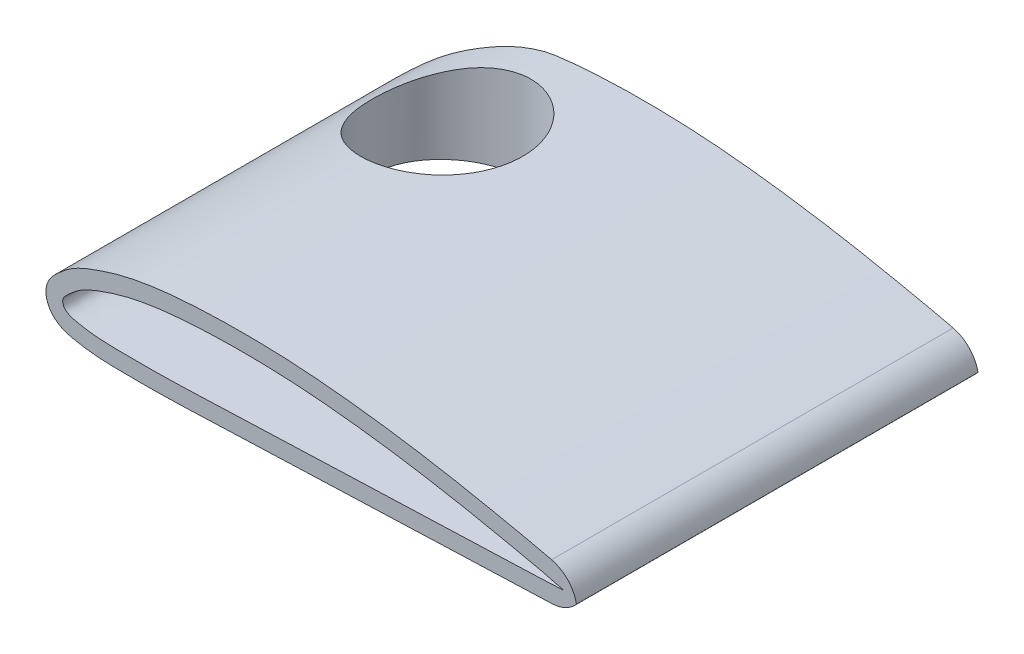
from build123d import *

# Parameters (mm, degrees)
BOSS_EXTRUDE1_DEPTH             = 120
BOSS_EXTRUDE2_DEPTH             = 10
BOSS_EXTRUDE3_REACH             = 199.677
SKETCH4_W                       = 65
SKETCH4_H                       = 65
BOSS_EXTRUDE3_DIRECTION_2_REACH = 199.677
CUT_EXTRUDE1_DEPTH              = 33
CUT_EXTRUDE1_DEPTH_BACK         = 25
SKETCH4_2_R                     = 22.5
FILLET1_START                   = -1
FILLET1_DEPTH                   = 121
CUT_EXTRUDE2_DEPTH              = 20
CUT_EXTRUDE2_DEPTH_BACK         = 15


with BuildPart() as part:
    # Sketch1 → Boss-Extrude1 (new body)
    with BuildSketch(Plane.XY):
        with BuildLine():
            Line((155.964316355, 3.565709543), (153.766293041, -4.802384858))
            add(Edge.make_bspline(
                [(155.964316355, 3.565709543), (154.378918322, 3.982141489), (151.221438672, 4.810628214), (146.405320696, 6.079621314), (141.459245587, 7.230960659), (136.616503343, 8.262254652), (131.802332964, 9.280625302), (125.348017994, 10.621960321), (117.229574348, 12.22271703), (107.436037499, 13.939301482), (97.598738468, 15.440763267), (87.722266926, 16.70627728), (77.809714958, 17.733057917), (67.80793717, 18.447035533), (57.793889713, 18.773182879), (47.769770538, 18.735457883), (39.427372262, 18.401151216), (32.680462384, 17.878299596), (27.594300218, 17.298704257), (22.489228117, 16.489212541), (18.221832789, 15.571293682), (14.817024759, 14.645782316), (12.31084577, 13.860390887), (9.867125223, 13.00783032), (7.415344177, 12.101980937), (5.199464012, 11.150322343), (3.406195729, 10.198694172), (2.068067577, 9.360164368), (0.853940441, 8.472821349), (-0.27162176, 7.553930707), (-1.173806492, 6.752832287), (-1.846273696, 6.138489504), (-2.510294599, 5.508824521), (-3.293762827, 4.650066841), (-4.139995357, 3.446744203), (-4.757454598, 1.999926732), (-5.006000217, 0.577057349), (-5.004495543, -0.947409484), (-4.641359358, -2.460021664), (-3.864975901, -4.058175269), (-2.796093096, -5.367757007), (-1.242943599, -6.635774778), (0.617085196, -7.509451493), (2.507225543, -8.035896586), (3.957529203, -8.334387132), (5.333798484, -8.592798441), (6.682167164, -8.804467221), (8.44379095, -9.033373876), (10.618251219, -9.22995636), (13.224767296, -9.364305661), (15.802696221, -9.430728222), (18.31698775, -9.462575421), (21.643533924, -9.488754653), (25.784013425, -9.483315396), (30.754262974, -9.411201744), (35.715989191, -9.27948568), (40.663768741, -9.11030498), (47.232199521, -8.859800124), (55.41703855, -8.546503659), (65.236994413, -8.175473725), (75.060452553, -7.813776944), (84.888517086, -7.455428603), (97.997779582, -6.971840733), (114.364222088, -6.367752612), (129.11790303, -5.838888298), (138.932090495, -5.485670307), (143.859307965, -5.314572629), (148.872305041, -5.077337716), (152.127761912, -4.891949037), (153.766293041, -4.802384858)],
                knots=[-0.016327191, -0.016327191, -0.016327191, -0.016327191, -0.000269294, 0.015788604, 0.031846501, 0.047904399, 0.063962296, 0.080020194, 0.112135989, 0.144251784, 0.176367579, 0.208483374, 0.240599169, 0.272714964, 0.30483076, 0.336946555, 0.36906235, 0.385120247, 0.401178145, 0.417236042, 0.43329394, 0.441322889, 0.449351837, 0.457380786, 0.465409735, 0.473438684, 0.477453158, 0.481467632, 0.485482107, 0.489496581, 0.493511056, 0.495518293, 0.49752553, 0.499532767, 0.501540004, 0.503547242, 0.50455086, 0.505554479, 0.507561716, 0.509568953, 0.51157619, 0.513583428, 0.517597902, 0.521612376, 0.525626851, 0.529641325, 0.533655799, 0.537670274, 0.545699223, 0.553728171, 0.56175712, 0.569786069, 0.577815018, 0.593872915, 0.609930813, 0.62598871, 0.642046608, 0.658104505, 0.6902203, 0.722336096, 0.754451891, 0.786567686, 0.818683481, 0.882915071, 0.947146661, 0.963204559, 0.979262456, 0.995320354, 1.011378251, 1.011378251, 1.011378251, 1.011378251], degree=3))
        make_face()
        with BuildLine():
            Line((149.858113324, 0), (149.855835651, -0.00867133))
            add(Edge.make_bspline(
                [(149.858113324, 0), (148.064864637, 0.471027481), (143.224769961, 1.742362118), (133.175670914, 3.886034627), (119.499496989, 6.758253215), (102.541429982, 9.744438365), (85.964517719, 11.956268792), (70.816843468, 13.313775138), (56.667826786, 13.848112216), (41.764744871, 13.642732387), (27.878301368, 12.538757837), (17.516862727, 10.350224421), (10.936048166, 8.121191966), (5.628206266, 6.017279046), (2.240759138, 3.159947775), (-0.293696922, 0.719700584), (0.542306535, -2.400763115), (4.956625023, -3.537663372), (10.612229447, -4.327824942), (18.770818109, -4.498199411), (30.500536827, -4.493359859), (45.784466548, -3.912234803), (66.370760986, -3.122790256), (87.01625275, -2.378102064), (108.487999193, -1.576150156), (124.547177916, -1.002761448), (137.784916862, -0.521876849), (145.122318881, -0.266429976), (148.916898874, -0.059994798), (149.855835651, -0.00867133)],
                knots=[0, 0, 0, 0, 0.018163138, 0.049023492, 0.100643645, 0.155079573, 0.217678279, 0.264435784, 0.304025298, 0.356345356, 0.410393025, 0.44030719, 0.459595641, 0.478843318, 0.494821298, 0.504998978, 0.508601056, 0.524256235, 0.542615557, 0.567476747, 0.602874089, 0.658123072, 0.717036036, 0.804816302, 0.860486783, 0.927555311, 0.962250043, 0.990268591, 0.999481252, 0.999481252, 0.999481252, 0.999481252], degree=3))
        make_face(mode=Mode.SUBTRACT)
    extrude(amount=BOSS_EXTRUDE1_DEPTH)

    # Sketch3 → Boss-Extrude2 (add)
    with BuildSketch(Plane(origin=(0, 0, 0), x_dir=(-1, 0, 0), z_dir=(0, 0, -1))):
        with BuildLine():
            add(Edge.make_bspline(
                [(0.878784699, 2.816886777), (-0.440330705, 4.35710096), (-6.432358309, 9.398319725), (-25.880607147, 15.556199748), (-57.640660956, 15.486635628), (-94.316428091, 14.90132494), (-121.955402319, 9.416295338), (-155.648348192, 3.742322043), (-152.299631395, -5.019044201), (-127.442883747, -2.619953533), (-110.657226211, -5.850784995), (-70.675350432, -4.951680612), (-43.15497178, -7.181610376), (-11.739005475, -7.267310955), (7.783964303, -5.245679637), (0.878784699, 2.816886777)],
                knots=[0, 0, 0, 0, 0.019858562, 0.056297241, 0.104261526, 0.197906982, 0.252888713, 0.300349685, 0.312342472, 0.372816584, 0.481473762, 0.67443882, 0.863490173, 0.896046291, 1, 1, 1, 1], degree=3))
        make_face()
    extrude(amount=-BOSS_EXTRUDE2_DEPTH)

    # Sketch4 → Boss-Extrude3 (add, up to next)
    with BuildSketch(Plane(origin=(0, 0, 0), x_dir=(1, 0, 0), z_dir=(0, 1, 0)), mode=Mode.PRIVATE) as boss_extrude3_sk1:
        with Locations((27.501426989, -32.5)):
            Rectangle(SKETCH4_W, SKETCH4_H)
    boss_extrude3_tool1 = extrude(boss_extrude3_sk1.sketch, amount=BOSS_EXTRUDE3_REACH, mode=Mode.PRIVATE) - part.part
    add(boss_extrude3_tool1.solids().sort_by_distance((27.501427, 0, 32.5))[0])

    # Sketch4 → Boss-Extrude3 direction 2 (add, up to next)
    with BuildSketch(Plane(origin=(0, 0, 0), x_dir=(1, 0, 0), z_dir=(0, 1, 0)), mode=Mode.PRIVATE) as boss_extrude3_direction_2_sk1:
        with Locations((27.501426989, -32.5)):
            Rectangle(SKETCH4_W, SKETCH4_H)
    boss_extrude3_direction_2_tool1 = extrude(boss_extrude3_direction_2_sk1.sketch, amount=-BOSS_EXTRUDE3_DIRECTION_2_REACH, mode=Mode.PRIVATE) - part.part
    add(boss_extrude3_direction_2_tool1.solids().sort_by_distance((27.501427, 0, 32.5))[0])

    # Sketch4<2> → Cut-Extrude1 (cut, two sides: drawn at the far end of the back side and taken through both)
    with BuildSketch(Plane(origin=(0, 0, 0), x_dir=(1, 0, 0), z_dir=(0, 1, 0)).offset(-CUT_EXTRUDE1_DEPTH_BACK)):
        with Locations(Location((27.501426989, -32.5, 0), (0, 0, 90))):
            Circle(SKETCH4_2_R)
    extrude(amount=CUT_EXTRUDE1_DEPTH + CUT_EXTRUDE1_DEPTH_BACK, mode=Mode.SUBTRACT)

    # Fillet1: read off the stored shape, not the designer's step
    # Fillet1 outline → Fillet1 (cut)
    with BuildSketch(Plane.XY.offset(FILLET1_START)):
        with BuildLine():
            add(Edge.make_bspline(
                [(155.964316355, 3.565709543), (154.378918322, 3.982141489), (151.221438672, 4.810628214), (147.930041559, 5.677874458), (146.220126624, 6.100494295), (146.138282279, 6.120660977)],
                knots=[-0.016327191, -0.016327191, -0.016327191, -0.016327191, -0.000269294, 0.015788604, 0.016595331, 0.016595331, 0.016595331, 0.016595331], degree=3))
            ThreePointArc((146.138282279, 6.120660977), (150.991487115, 3.303111972), (153.562870933, -1.684890116))
            ThreePointArc((153.562870933, -1.684890116), (150.354667633, -4.179306809), (146.418835534, -5.19119057))
            add(Edge.make_bspline(
                [(146.418835534, -5.19119057), (147.231820092, -5.152928346), (149.703780843, -5.029987618), (152.127761912, -4.891949037), (153.766293041, -4.802384858)],
                knots=[0.987465147, 0.987465147, 0.987465147, 0.987465147, 0.995320354, 1.011378251, 1.011378251, 1.011378251, 1.011378251], degree=3))
            Line((153.766293041, -4.802384858), (155.964316355, 3.565709543))
        make_face()
    extrude(amount=FILLET1_DEPTH, mode=Mode.SUBTRACT)

    # Sketch6 → Cut-Extrude2 (cut, two sides: drawn at the far end of the back side and taken through both)
    with BuildSketch(Plane(origin=(0, 0, 0), x_dir=(1, 0, 0), z_dir=(0, 1, 0)).offset(-CUT_EXTRUDE2_DEPTH_BACK)):
        with BuildLine():
            Line((-4.998573011, -32.5), (-4.998573011, 0))
            Line((-4.998573011, 0), (27.501426989, 0))
            ThreePointArc((27.501426989, 0), (4.5204566, -9.519029611), (-4.998573011, -32.5))
        make_face()
    extrude(amount=CUT_EXTRUDE2_DEPTH + CUT_EXTRUDE2_DEPTH_BACK, mode=Mode.SUBTRACT)


solid = part.part
